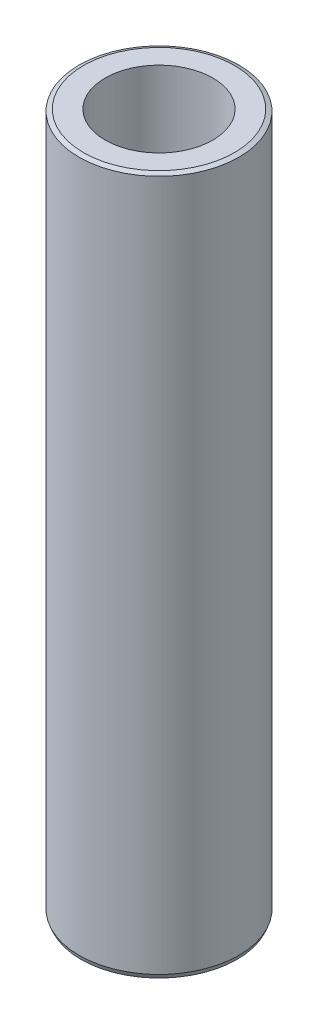
from build123d import *
from OCP.BRepFilletAPI import BRepFilletAPI_MakeChamfer

# Parameters (mm, degrees)
SKETCH1_R           = 20
BOSS_EXTRUDE1_DEPTH = 174.573456397
SKETCH2_R           = 13.476711323
CUT_EXTRUDE1_DEPTH  = 177.84991286
CHAMFER1_SIZE       = 0.451018003
CHAMFER1_SIZE2      = 1.10153372


with BuildPart() as part:
    # Sketch1 → Boss-Extrude1 (new body)
    with BuildSketch(Plane(origin=(0, 0, 0), x_dir=(1, 0, 0), z_dir=(0, 1, 0))):
        Circle(SKETCH1_R)
    extrude(amount=BOSS_EXTRUDE1_DEPTH)

    # Sketch2 → Cut-Extrude1 (cut, through all)
    with BuildSketch(Plane(origin=(0, 0, 0), x_dir=(1, 0, 0), z_dir=(0, 1, 0))):
        Circle(SKETCH2_R)
    extrude(amount=CUT_EXTRUDE1_DEPTH, mode=Mode.SUBTRACT)

    # Chamfer1: one chamfer whose edges measure the first distance from different faces: ONE call of the kernel's chamfer builder (chamfer() names one face for all edges)
    chamfer1_edges_1 = [part.edges().sort_by_distance(p)[0] for p in [
        (-20, 174.573456397, 0),
    ]]
    chamfer1_side_1 = [part.faces().sort_by_distance(p)[0] for p in [
        (-20, 87.286728199, 0),
    ]]
    chamfer1_edges_2 = [part.edges().sort_by_distance(p)[0] for p in [
        (-20, 0, 0),
    ]]
    chamfer1_side_2 = [part.faces().sort_by_distance(p)[0] for p in [
        (-19.434314575, 0, 0),
    ]]
    chamfer1 = BRepFilletAPI_MakeChamfer(part.part.solid().wrapped)
    for e in chamfer1_edges_1:
        chamfer1.Add(CHAMFER1_SIZE, CHAMFER1_SIZE2, e.wrapped, chamfer1_side_1[0].wrapped)  # the first distance lies on this face
    for e in chamfer1_edges_2:
        chamfer1.Add(CHAMFER1_SIZE, CHAMFER1_SIZE2, e.wrapped, chamfer1_side_2[0].wrapped)  # the first distance lies on this face
    add(Compound.cast(chamfer1.Shape()), mode=Mode.REPLACE)


solid = part.part
